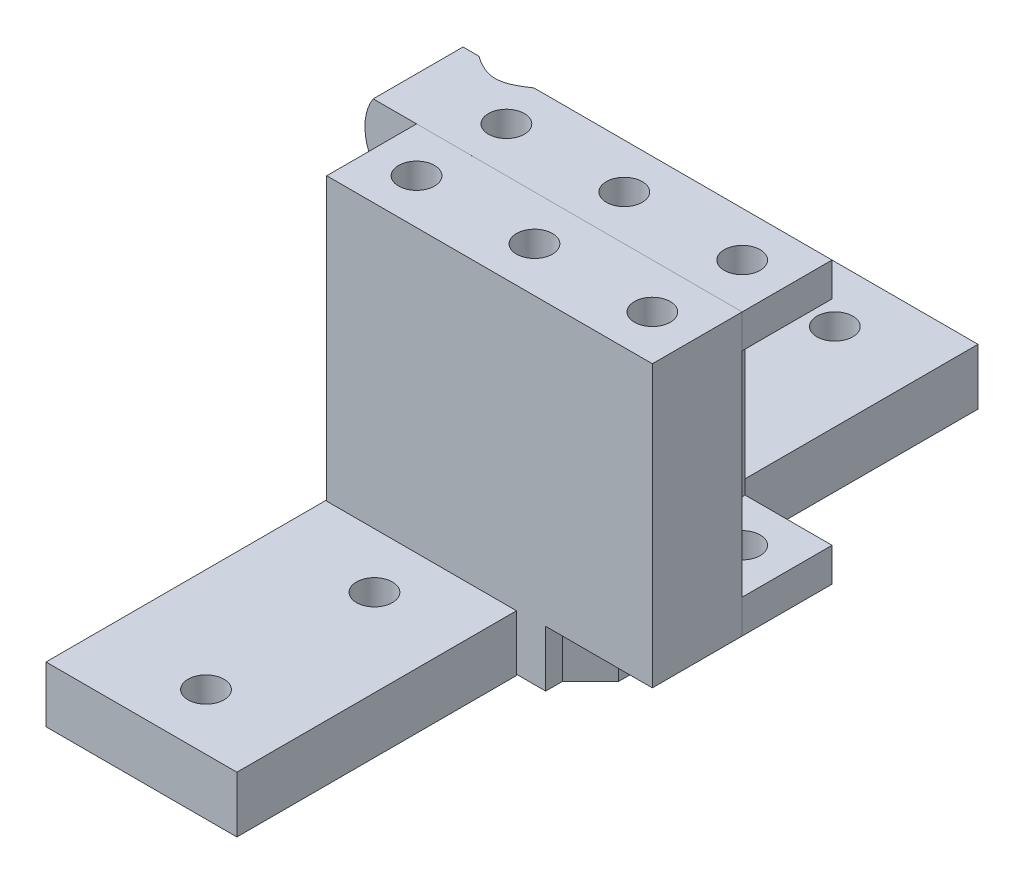
from build123d import *

# Parameters (mm, degrees)
MIRROR_START             = -11.571280035
MIRROR_1_OUTLINE_W       = 17
MIRROR_1_OUTLINE_H       = 24.9
MIRROR_1_OUTLINE_R       = 1.6
MIRROR_1_DEPTH           = 5
MIRROR_START_2           = 0.238719965
MIRROR_1_2_OUTLINE_W     = 29
MIRROR_1_2_OUTLINE_H     = 8
MIRROR_1_2_OUTLINE_R     = 1.6
MIRROR_1_2_DEPTH         = 18.19
MIRROR_1_3_OUTLINE_R     = 1.6
MIRROR_1_3_DEPTH         = 30
MIRROR_START_3           = -5.831280035
MIRROR_1_4_OUTLINE_R     = 1.6
MIRROR_1_4_OUTLINE_W     = 9.95
MIRROR_1_4_OUTLINE_H     = 6.5
MIRROR_1_4_DEPTH         = 4.52
MIRROR_1_5_OUTLINE_W     = 10.8
MIRROR_1_5_OUTLINE_H     = 6.5
MIRROR_1_5_OUTLINE_R     = 1.6
MIRROR_1_5_DEPTH         = 4.19
MIRROR_START_4           = -6.571280035
MIRROR_1_6_OUTLINE_R     = 1.6
MIRROR_1_6_DEPTH         = 25
MIRROR_START_5           = -2.980274528
MIRROR_1_7_DEPTH         = 6.5
MIRROR_START_6           = -7.381280035
MIRROR_1_8_OUTLINE_R     = 1.6
MIRROR_1_8_DEPTH         = 7.62
MIRROR_1_9_OUTLINE_W     = 29
MIRROR_1_9_OUTLINE_H     = 8
MIRROR_1_9_OUTLINE_R     = 1.6
MIRROR_1_9_DEPTH         = 18.19
MIRROR_1_10_OUTLINE_R    = 1.6
MIRROR_1_10_DEPTH        = 30
MIRROR_1_11_OUTLINE_R    = 1.6
MIRROR_1_11_OUTLINE_W    = 9.95
MIRROR_1_11_OUTLINE_H    = 6.5
MIRROR_1_11_DEPTH        = 4.52
MIRROR_1_12_OUTLINE_W    = 10.8
MIRROR_1_12_OUTLINE_H    = 6.5
MIRROR_1_12_OUTLINE_R    = 1.6
MIRROR_1_12_DEPTH        = 4.19
MIRROR_1_13_OUTLINE_R    = 1.6
MIRROR_1_13_DEPTH        = 25
MIRROR_START_7           = 3.519725472
MIRROR_1_14_DEPTH        = 6.5
MIRROR_1_15_OUTLINE_R    = 1.6
MIRROR_1_15_DEPTH        = 7.62
MIRROR_1_16_OUTLINE_W    = 17
MIRROR_1_16_OUTLINE_H    = 24.9
MIRROR_1_16_OUTLINE_R    = 1.6
MIRROR_1_16_DEPTH        = 5
SKETCH_8_R               = 1.6
SKETCH_8_W               = 15.5
SKETCH_8_H               = 19
CUT_EXTRUDE_1_DEPTH      = 10
CUT_EXTRUDE_2_DEPTH      = 10
EXTRUDE_1_DEPTH          = 8
HOLE_WIZARD_1_AT_2_COUNT = 2
HOLE_WIZARD_1_AT_2_PITCH = 7
HOLE_WIZARD_1_AT_3_COUNT = 2
HOLE_WIZARD_1_AT_3_PITCH = 8.732124598


with BuildPart() as part:
    # 镜向1: read off the stored shape, not the designer's step
    # 镜向1 outline → 镜向1 (new body)
    with BuildSketch(Plane(origin=(0, 0, 0), x_dir=(1, 0, 0), z_dir=(0, 1, 0)).offset(MIRROR_START)):
        with Locations((-7.448782051, 17.030274528)):
            Rectangle(MIRROR_1_OUTLINE_W, MIRROR_1_OUTLINE_H)
        with Locations((-6.698782051, 9.480274528)):
            Circle(MIRROR_1_OUTLINE_R, mode=Mode.SUBTRACT)
        with Locations((-6.698782051, 24.480274528)):
            Circle(MIRROR_1_OUTLINE_R, mode=Mode.SUBTRACT)
    extrude(amount=MIRROR_1_DEPTH)


with BuildPart() as body_2:
    # Mirror 1 2 outline → Mirror 1 2 (new body)
    with BuildSketch(Plane(origin=(0, 0, 0), x_dir=(1, 0, 0), z_dir=(0, 1, 0)).offset(MIRROR_START_2)):
        with Locations((-1.448782051, 0.480274528)):
            Rectangle(MIRROR_1_2_OUTLINE_W, MIRROR_1_2_OUTLINE_H)
        with Locations((9.051217949, 0.480274528)):
            Circle(MIRROR_1_2_OUTLINE_R, mode=Mode.SUBTRACT)
        with Locations((-11.948782051, 0.480274528)):
            Circle(MIRROR_1_2_OUTLINE_R, mode=Mode.SUBTRACT)
        with Locations((-1.448782051, 0.480274528)):
            Circle(MIRROR_1_2_OUTLINE_R, mode=Mode.SUBTRACT)
    extrude(amount=MIRROR_1_2_DEPTH)

    # Mirror 1 3 outline → Mirror 1 3 (add)
    with BuildSketch(Plane(origin=(0, 0, 0), x_dir=(1, 0, 0), z_dir=(0, 1, 0)).offset(MIRROR_START)):
        Polygon((3.551217949, 2.980274528), (3.551217949, 4.480274528), (-15.948782051, 4.480274528), (-15.948782051, -3.519725472), (-8.498782051, -3.519725472), (-8.498782051, 2.980274528), (2.301217949, 2.980274528), (2.301217949, -3.519725472), (6.051217949, -3.519725472), (6.051217949, 0.480274528), align=None)
        with Locations((-11.948782051, 0.480274528)):
            Circle(MIRROR_1_3_OUTLINE_R, mode=Mode.SUBTRACT)
    extrude(amount=MIRROR_1_3_DEPTH)

    # Mirror 1 4 outline → Mirror 1 4 (add)
    # profile 1 of 2: a face of its own
    with BuildSketch(Plane(origin=(0, 0, 0), x_dir=(1, 0, 0), z_dir=(0, 1, 0)).offset(MIRROR_START_3)):
        Polygon((13.051217949, -3.519725472), (13.051217949, 4.480274528), (3.551217949, 4.480274528), (3.551217949, 2.980274528), (6.051217949, 0.480274528), (6.051217949, -3.519725472), align=None)
        with Locations((9.051217949, 0.480274528)):
            Circle(MIRROR_1_4_OUTLINE_R, mode=Mode.SUBTRACT)
    # profile 2 of 2: a face of its own
    with BuildSketch(Plane(origin=(0, 0, 0), x_dir=(1, 0, 0), z_dir=(0, 1, 0)).offset(MIRROR_START_3)):
        with Locations((-3.523782051, -0.269725472)):
            Rectangle(MIRROR_1_4_OUTLINE_W, MIRROR_1_4_OUTLINE_H)
        with Locations((-1.448782051, 0.480274528)):
            Circle(MIRROR_1_4_OUTLINE_R, mode=Mode.SUBTRACT)
    extrude(amount=MIRROR_1_4_DEPTH)

    # Mirror 1 5 outline → Mirror 1 5 (add)
    with BuildSketch(Plane(origin=(0, 0, 0), x_dir=(1, 0, 0), z_dir=(0, 1, 0)).offset(MIRROR_START)):
        with Locations((-3.098782051, -0.269725472)):
            Rectangle(MIRROR_1_5_OUTLINE_W, MIRROR_1_5_OUTLINE_H)
        with Locations((-1.448782051, 0.480274528)):
            Circle(MIRROR_1_5_OUTLINE_R, mode=Mode.SUBTRACT)
    extrude(amount=MIRROR_1_5_DEPTH)

    # Mirror 1 6 outline → Mirror 1 6 (add)
    with BuildSketch(Plane(origin=(0, 0, 0), x_dir=(1, 0, 0), z_dir=(0, 1, 0)).offset(MIRROR_START_4)):
        Polygon((13.051217949, -3.519725472), (13.051217949, 4.480274528), (3.551217949, 4.480274528), (3.551217949, 2.980274528), (6.051217949, 0.480274528), (6.051217949, -3.519725472), align=None)
        with Locations((9.051217949, 0.480274528)):
            Circle(MIRROR_1_6_OUTLINE_R, mode=Mode.SUBTRACT)
    extrude(amount=MIRROR_1_6_DEPTH)

    # Mirror 1 7 outline → Mirror 1 7 (add)
    with BuildSketch(Plane.XY.offset(MIRROR_START_5)):
        with BuildLine():
            Line((1.251217949, -1.111280035), (-8.498782051, -1.111280035))
            Line((-8.498782051, -1.111280035), (-8.498782051, -1.311280035))
            Line((-8.498782051, -1.311280035), (1.451217949, -1.311280035))
            ThreePointArc((1.451217949, -1.311280035), (1.392639305, -1.169858679), (1.251217949, -1.111280035))
        make_face()
        with BuildLine():
            ThreePointArc((1.301217949, -0.261280035), (1.447664558, 0.092273356), (1.801217949, 0.238719965))
            Line((1.801217949, 0.238719965), (-8.498782051, 0.238719965))
            Line((-8.498782051, 0.238719965), (-8.498782051, -0.261280035))
            Line((-8.498782051, -0.261280035), (1.301217949, -0.261280035))
        make_face()
        with BuildLine():
            Line((-8.498782051, -5.831280035), (-8.498782051, -6.031280035))
            Line((-8.498782051, -6.031280035), (1.251217949, -6.031280035))
            ThreePointArc((1.251217949, -6.031280035), (1.392639305, -5.972701391), (1.451217949, -5.831280035))
            Line((1.451217949, -5.831280035), (-8.498782051, -5.831280035))
        make_face()
        with BuildLine():
            Line((-8.498782051, -7.381280035), (1.801217949, -7.381280035))
            ThreePointArc((1.801217949, -7.381280035), (1.447664558, -7.234833426), (1.301217949, -6.881280035))
            Line((1.301217949, -6.881280035), (-8.498782051, -6.881280035))
            Line((-8.498782051, -6.881280035), (-8.498782051, -7.381280035))
        make_face()
        with BuildLine():
            Line((2.301217949, -7.381280035), (2.301217949, -6.881280035))
            ThreePointArc((2.301217949, -6.881280035), (2.15477134, -7.234833426), (1.801217949, -7.381280035))
            Line((1.801217949, -7.381280035), (2.301217949, -7.381280035))
        make_face()
        with BuildLine():
            ThreePointArc((1.801217949, 0.238719965), (2.15477134, 0.092273356), (2.301217949, -0.261280035))
            Line((2.301217949, -0.261280035), (2.301217949, 0.238719965))
            Line((2.301217949, 0.238719965), (1.801217949, 0.238719965))
        make_face()
    extrude(amount=MIRROR_1_7_DEPTH)

    # Mirror 1 8 outline → Mirror 1 8 (cut)
    with BuildSketch(Plane(origin=(0, 0, 0), x_dir=(1, 0, 0), z_dir=(0, 1, 0)).offset(MIRROR_START_6)):
        with Locations((-1.448782051, 0.480274528)):
            Circle(MIRROR_1_8_OUTLINE_R)
    extrude(amount=MIRROR_1_8_DEPTH, mode=Mode.SUBTRACT)

    # Sketch 8 → 切除-拉伸1 (cut)
    with BuildSketch(Plane.XY.offset(3.519725472)):
        with Locations((-7.948782051, 12.428719965)):
            Circle(SKETCH_8_R)
        with Locations((13.051217949, 5.928719965)):
            Rectangle(SKETCH_8_W, SKETCH_8_H)
    extrude(amount=-CUT_EXTRUDE_1_DEPTH, mode=Mode.SUBTRACT)

    # Sketch 9 → 切除-拉伸2 (cut)
    with BuildSketch(Plane.XY.offset(3.519725472)):
        with BuildLine():
            Line((-15.948782051, 7.328719965), (-15.948782051, 10.528719965))
            ThreePointArc((-15.948782051, 10.528719965), (-17.548782051, 8.928719965), (-15.948782051, 7.328719965))
        make_face()
        with BuildLine():
            ThreePointArc((-14.348782051, 8.928719965), (-14.817411201, 10.060090815), (-15.948782051, 10.528719965))
            Line((-15.948782051, 10.528719965), (-15.948782051, 7.328719965))
            ThreePointArc((-15.948782051, 7.328719965), (-14.817411201, 7.797349115), (-14.348782051, 8.928719965))
        make_face()
        with BuildLine():
            Line((-15.948782051, 14.328719965), (-15.948782051, 17.528719965))
            ThreePointArc((-15.948782051, 17.528719965), (-17.548782051, 15.928719965), (-15.948782051, 14.328719965))
        make_face()
        with BuildLine():
            ThreePointArc((-14.348782051, 15.928719965), (-14.817411201, 17.060090815), (-15.948782051, 17.528719965))
            Line((-15.948782051, 17.528719965), (-15.948782051, 14.328719965))
            ThreePointArc((-15.948782051, 14.328719965), (-14.817411201, 14.797349115), (-14.348782051, 15.928719965))
        make_face()
    extrude(amount=-CUT_EXTRUDE_2_DEPTH, mode=Mode.SUBTRACT)

    # 草图9<3> → 凸台-拉伸1 (add)
    with BuildSketch(Plane.XY.offset(3.519725472)):
        with BuildLine():
            Line((-15.948782051, 17.528719965), (-15.948782051, 18.428719965))
            Line((-15.948782051, 18.428719965), (-19.810128966, 18.428719965))
            ThreePointArc((-19.810128966, 18.428719965), (-20.500483657, 15.263879763), (-18.933744362, 12.428719965))
            ThreePointArc((-18.933744362, 12.428719965), (-20.265030422, 7.338122593), (-15.948782051, 4.328719965))
            Line((-15.948782051, 4.328719965), (-15.948782051, 7.328719965))
            ThreePointArc((-15.948782051, 7.328719965), (-17.548782051, 8.928719965), (-15.948782051, 10.528719965))
            Line((-15.948782051, 10.528719965), (-15.948782051, 14.328719965))
            ThreePointArc((-15.948782051, 14.328719965), (-17.548782051, 15.928719965), (-15.948782051, 17.528719965))
        make_face()
    extrude(amount=-EXTRUDE_1_DEPTH)

    # Sketch 10 → 打孔尺寸(%根据十字)槽沉头木螺钉的类型1 (revolve, cut)
    with BuildSketch(Plane(origin=(-15.948782051, 8.928719965, -4.480274528), x_dir=(0, 1, 0), z_dir=(1, 0, 0))):
        Polygon((0, 0), (0, 41), (1.6, 41), (1.6, 1.9), (3.5, 0), align=None)
    hole_wizard_1 = revolve(axis=Axis((-15.948782051, 8.928719965, -10.830274528), (0, 0, 1)), mode=Mode.SUBTRACT)

    # 打孔尺寸(%根据十字)槽沉头木螺钉的类型1 at 2: 打孔尺寸(%根据十字)槽沉头木螺钉的类型1 ×2
    with Locations(*[(0, i * HOLE_WIZARD_1_AT_2_PITCH, 0) for i in range(1, HOLE_WIZARD_1_AT_2_COUNT)]):
        add(hole_wizard_1, mode=Mode.SUBTRACT)

    # 打孔尺寸(%根据十字)槽沉头木螺钉的类型1 at 3: 打孔尺寸(%根据十字)槽沉头木螺钉的类型1 ×2
    with Locations(*[Vector(0.9161573349021892, 0.4008188340197078, 0) * (i * HOLE_WIZARD_1_AT_3_PITCH) for i in range(1, HOLE_WIZARD_1_AT_3_COUNT)]):
        add(hole_wizard_1, mode=Mode.SUBTRACT)


with BuildPart() as body_3:
    # Mirror 1 9 outline → Mirror 1 9 (new body)
    with BuildSketch(Plane(origin=(0, 0, 0), x_dir=(1, 0, 0), z_dir=(0, 1, 0)).offset(MIRROR_START_2)):
        with Locations((-1.448782051, -7.519725472)):
            Rectangle(MIRROR_1_9_OUTLINE_W, MIRROR_1_9_OUTLINE_H)
        with Locations((-11.948782051, -7.519725472)):
            Circle(MIRROR_1_9_OUTLINE_R, mode=Mode.SUBTRACT)
        with Locations((-1.448782051, -7.519725472)):
            Circle(MIRROR_1_9_OUTLINE_R, mode=Mode.SUBTRACT)
        with Locations((9.051217949, -7.519725472)):
            Circle(MIRROR_1_9_OUTLINE_R, mode=Mode.SUBTRACT)
    extrude(amount=MIRROR_1_9_DEPTH)

    # Mirror 1 10 outline → Mirror 1 10 (add)
    with BuildSketch(Plane(origin=(0, 0, 0), x_dir=(1, 0, 0), z_dir=(0, 1, 0)).offset(MIRROR_START)):
        Polygon((-15.948782051, -3.519725472), (-15.948782051, -11.519725472), (3.551217949, -11.519725472), (3.551217949, -10.019725472), (6.051217949, -7.519725472), (6.051217949, -3.519725472), (2.301217949, -3.519725472), (2.301217949, -10.019725472), (-8.498782051, -10.019725472), (-8.498782051, -3.519725472), align=None)
        with Locations((-11.948782051, -7.519725472)):
            Circle(MIRROR_1_10_OUTLINE_R, mode=Mode.SUBTRACT)
    extrude(amount=MIRROR_1_10_DEPTH)

    # Mirror 1 11 outline → Mirror 1 11 (add)
    # profile 1 of 2: a face of its own
    with BuildSketch(Plane(origin=(0, 0, 0), x_dir=(1, 0, 0), z_dir=(0, 1, 0)).offset(MIRROR_START_3)):
        Polygon((3.551217949, -10.019725472), (3.551217949, -11.519725472), (13.051217949, -11.519725472), (13.051217949, -3.519725472), (6.051217949, -3.519725472), (6.051217949, -7.519725472), align=None)
        with Locations((9.051217949, -7.519725472)):
            Circle(MIRROR_1_11_OUTLINE_R, mode=Mode.SUBTRACT)
    # profile 2 of 2: a face of its own
    with BuildSketch(Plane(origin=(0, 0, 0), x_dir=(1, 0, 0), z_dir=(0, 1, 0)).offset(MIRROR_START_3)):
        with Locations((-3.523782051, -6.769725472)):
            Rectangle(MIRROR_1_11_OUTLINE_W, MIRROR_1_11_OUTLINE_H)
        with Locations((-1.448782051, -7.519725472)):
            Circle(MIRROR_1_11_OUTLINE_R, mode=Mode.SUBTRACT)
    extrude(amount=MIRROR_1_11_DEPTH)

    # Mirror 1 12 outline → Mirror 1 12 (add)
    with BuildSketch(Plane(origin=(0, 0, 0), x_dir=(1, 0, 0), z_dir=(0, 1, 0)).offset(MIRROR_START)):
        with Locations((-3.098782051, -6.769725472)):
            Rectangle(MIRROR_1_12_OUTLINE_W, MIRROR_1_12_OUTLINE_H)
        with Locations((-1.448782051, -7.519725472)):
            Circle(MIRROR_1_12_OUTLINE_R, mode=Mode.SUBTRACT)
    extrude(amount=MIRROR_1_12_DEPTH)

    # Mirror 1 13 outline → Mirror 1 13 (add)
    with BuildSketch(Plane(origin=(0, 0, 0), x_dir=(1, 0, 0), z_dir=(0, 1, 0)).offset(MIRROR_START_4)):
        Polygon((3.551217949, -10.019725472), (3.551217949, -11.519725472), (13.051217949, -11.519725472), (13.051217949, -3.519725472), (6.051217949, -3.519725472), (6.051217949, -7.519725472), align=None)
        with Locations((9.051217949, -7.519725472)):
            Circle(MIRROR_1_13_OUTLINE_R, mode=Mode.SUBTRACT)
    extrude(amount=MIRROR_1_13_DEPTH)

    # Mirror 1 14 outline → Mirror 1 14 (add)
    with BuildSketch(Plane.XY.offset(MIRROR_START_7)):
        with BuildLine():
            Line((-8.498782051, -0.261280035), (1.301217949, -0.261280035))
            ThreePointArc((1.301217949, -0.261280035), (1.447664558, 0.092273356), (1.801217949, 0.238719965))
            Line((1.801217949, 0.238719965), (-8.498782051, 0.238719965))
            Line((-8.498782051, 0.238719965), (-8.498782051, -0.261280035))
        make_face()
        with BuildLine():
            Line((1.251217949, -1.111280035), (-8.498782051, -1.111280035))
            Line((-8.498782051, -1.111280035), (-8.498782051, -1.311280035))
            Line((-8.498782051, -1.311280035), (1.451217949, -1.311280035))
            ThreePointArc((1.451217949, -1.311280035), (1.392639305, -1.169858679), (1.251217949, -1.111280035))
        make_face()
        with BuildLine():
            Line((-8.498782051, -5.831280035), (-8.498782051, -6.031280035))
            Line((-8.498782051, -6.031280035), (1.251217949, -6.031280035))
            ThreePointArc((1.251217949, -6.031280035), (1.392639305, -5.972701391), (1.451217949, -5.831280035))
            Line((1.451217949, -5.831280035), (-8.498782051, -5.831280035))
        make_face()
        with BuildLine():
            Line((-8.498782051, -7.381280035), (1.801217949, -7.381280035))
            ThreePointArc((1.801217949, -7.381280035), (1.447664558, -7.234833426), (1.301217949, -6.881280035))
            Line((1.301217949, -6.881280035), (-8.498782051, -6.881280035))
            Line((-8.498782051, -6.881280035), (-8.498782051, -7.381280035))
        make_face()
        with BuildLine():
            Line((2.301217949, -7.381280035), (2.301217949, -6.881280035))
            ThreePointArc((2.301217949, -6.881280035), (2.15477134, -7.234833426), (1.801217949, -7.381280035))
            Line((1.801217949, -7.381280035), (2.301217949, -7.381280035))
        make_face()
        with BuildLine():
            Line((2.301217949, 0.238719965), (1.801217949, 0.238719965))
            ThreePointArc((1.801217949, 0.238719965), (2.15477134, 0.092273356), (2.301217949, -0.261280035))
            Line((2.301217949, -0.261280035), (2.301217949, 0.238719965))
        make_face()
    extrude(amount=MIRROR_1_14_DEPTH)

    # Mirror 1 15 outline → Mirror 1 15 (cut)
    with BuildSketch(Plane(origin=(0, 0, 0), x_dir=(1, 0, 0), z_dir=(0, 1, 0)).offset(MIRROR_START_6)):
        with Locations((-1.448782051, -7.519725472)):
            Circle(MIRROR_1_15_OUTLINE_R)
    extrude(amount=MIRROR_1_15_DEPTH, mode=Mode.SUBTRACT)


with BuildPart() as body_4:
    # Mirror 1 16 outline → Mirror 1 16 (new body)
    with BuildSketch(Plane(origin=(0, 0, 0), x_dir=(1, 0, 0), z_dir=(0, 1, 0)).offset(MIRROR_START)):
        with Locations((-7.448782051, -24.069725472)):
            Rectangle(MIRROR_1_16_OUTLINE_W, MIRROR_1_16_OUTLINE_H)
        with Locations((-6.698782051, -31.519725472)):
            Circle(MIRROR_1_16_OUTLINE_R, mode=Mode.SUBTRACT)
        with Locations((-6.698782051, -16.519725472)):
            Circle(MIRROR_1_16_OUTLINE_R, mode=Mode.SUBTRACT)
    extrude(amount=MIRROR_1_16_DEPTH)


solid = Compound([part.part, body_2.part, body_3.part, body_4.part])
